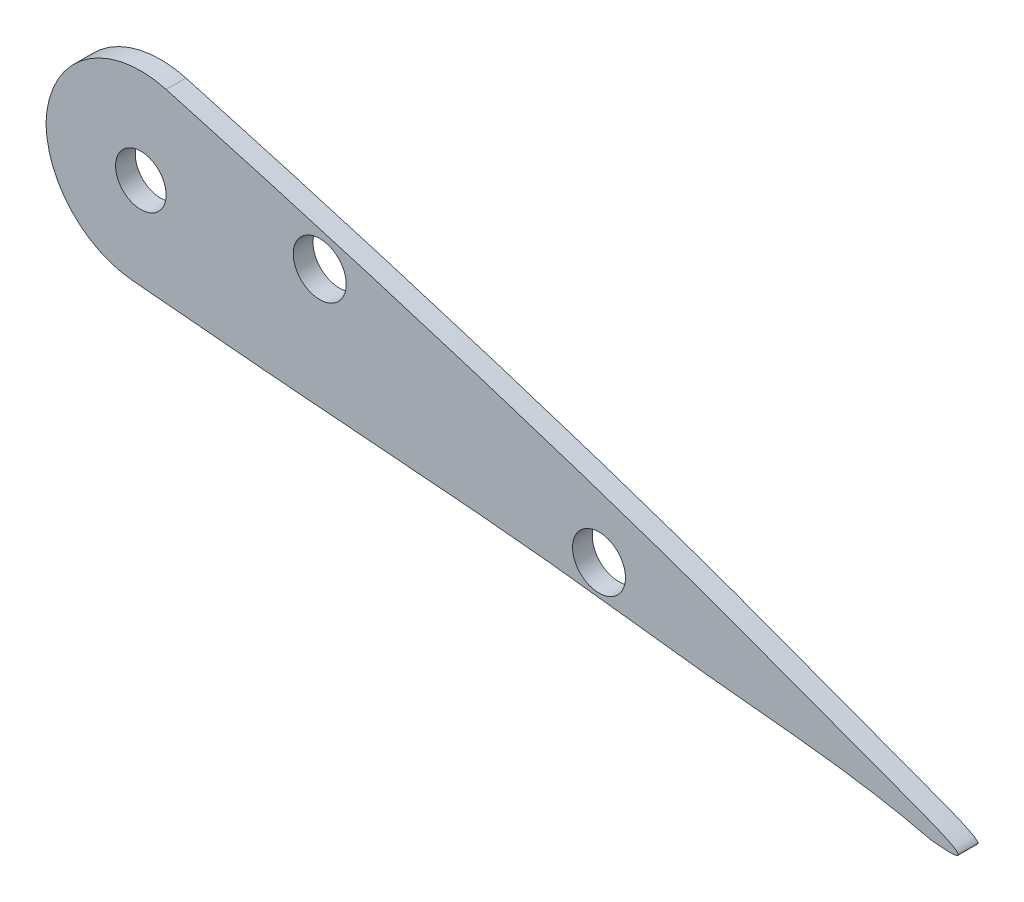
from build123d import *

# Parameters (mm, degrees)
BOSS_EXTRUDE1_DEPTH = 1.5875
SKETCH2_R           = 6.35
SKETCH2_R_2         = 3.175
CUT_EXTRUDE1_DEPTH  = 316.731983488
SKETCH3_W           = 329.065813824
SKETCH3_H           = 177.30262506
CUT_EXTRUDE2_DEPTH  = 316.731983488
FILLET1_DEPTH       = 1.5875
SKETCH4_R           = 2.032
CUT_EXTRUDE3_DEPTH  = 2.54
SKETCH5_R           = 2.127
CUT_EXTRUDE4_DEPTH  = 2.54


with BuildPart() as part:
    # Sketch1 → Boss-Extrude1 (new body)
    with BuildSketch(Plane.XY):
        with BuildLine():
            add(Edge.make_bspline(
                [(0.000560351, 0.000130087), (0.810633127, 7.359196055), (8.649092025, 17.856605174), (26.286719818, 29.975176328), (52.111128271, 42.069215275), (89.597618475, 49.290763054), (131.400792109, 47.884831915), (173.256699242, 40.041104278), (217.961060472, 29.612974894), (256.952064401, 19.528920948), (290.35983767, 8.71099439), (301.273197721, 4.382828139), (314.816918223, -0.516206742), (309.846313895, 0.000130087)],
                knots=[0, 0, 0, 0, 0.060863618, 0.113688265, 0.188608742, 0.312908923, 0.448482434, 0.557612135, 0.691544113, 0.852438279, 0.92975597, 0.976058229, 1, 1, 1, 1], degree=3))
            add(Edge.make_bspline(
                [(309.846313895, 0.000130087), (303.956832565, 1.47095521), (293.989507544, 2.093987313), (276.26402299, 4.514356704), (260.846344817, 5.427413394), (235.858814759, 7.870306192), (205.101424636, 8.838080282), (157.718638092, 9.030650149), (110.497331172, 6.181495223), (66.506197185, -0.586669107), (36.454672816, -6.098499901), (15.316603331, -6.189065841), (1.230714189, -6.924076091), (0.000560351, 0.000130087)],
                knots=[0, 0, 0, 0, 0.057787081, 0.095274891, 0.171021118, 0.205339302, 0.335319146, 0.464904334, 0.658702312, 0.785511947, 0.893517288, 0.94309214, 1, 1, 1, 1], degree=3))
        make_face()
    extrude(amount=BOSS_EXTRUDE1_DEPTH)

    # Sketch2 → Cut-Extrude1 (cut, through all)
    with BuildSketch(Plane.XY.offset(1.5875)):
        with Locations((20.32, 10.16)):
            Circle(SKETCH2_R)
        with Locations((227.296313895, 19.050130087)):
            Circle(SKETCH2_R_2)
    extrude(amount=-CUT_EXTRUDE1_DEPTH, mode=Mode.SUBTRACT)

    # Sketch3 → Cut-Extrude2 (cut, through all)
    with BuildSketch(Plane.XY.offset(1.5875)):
        with Locations((74.193406983, 18.895182109)):
            Rectangle(SKETCH3_W, SKETCH3_H)
    extrude(amount=-CUT_EXTRUDE2_DEPTH, mode=Mode.SUBTRACT)

    # Fillet1: read off the stored shape, not the designer's step
    # Fillet1 outline → Fillet1 (cut)
    with BuildSketch(Plane.XY):
        with BuildLine():
            ThreePointArc((245.711534403, 6.855899952), (240.78695405, 9.238088014), (238.727660088, 14.306186276))
            ThreePointArc((238.727660088, 14.306186276), (241.790276652, 20.270898068), (248.380487069, 21.506427765))
            add(Edge.make_bspline(
                [(248.380487069, 21.506427765), (245.14201846, 22.403497776), (241.927955434, 23.272784833), (238.726313893, 24.121097226)],
                knots=[0.203822749, 0.203822749, 0.203822749, 0.203822749, 0.233593651, 0.233593651, 0.233593651, 0.233593651], degree=3))
            Line((238.726313893, 24.121097226), (238.726313894, 7.379528673))
            add(Edge.make_bspline(
                [(238.726313894, 7.379528673), (241.056196666, 7.224072569), (243.384717208, 7.05041014), (245.711534403, 6.855899952)],
                knots=[0.772010011, 0.772010011, 0.772010011, 0.772010011, 0.794337025, 0.794337025, 0.794337025, 0.794337025], degree=3))
        make_face()
    extrude(amount=FILLET1_DEPTH, mode=Mode.SUBTRACT)

    # Sketch4 → Cut-Extrude3 (cut)
    with BuildSketch(Plane.XY.offset(1.5875)):
        with Locations((246.346313895, 14.162958592)):
            Circle(SKETCH4_R)
    extrude(amount=-CUT_EXTRUDE3_DEPTH, mode=Mode.SUBTRACT)

    # Sketch5 → Cut-Extrude4 (cut)
    with BuildSketch(Plane.XY.offset(1.5875)):
        with Locations((260.720225155, 15.178172845)):
            Circle(SKETCH5_R)
        with Locations((283.157187456, 5.977798132)):
            Circle(SKETCH5_R)
    extrude(amount=-CUT_EXTRUDE4_DEPTH, mode=Mode.SUBTRACT)


solid = part.part
